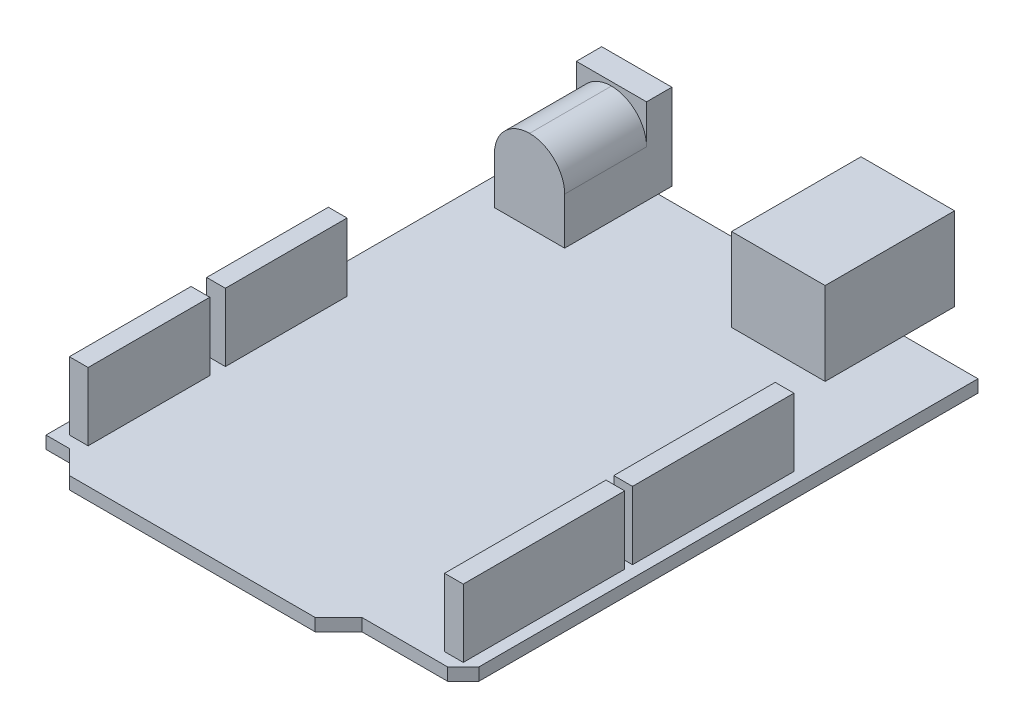
from build123d import *

# Parameters (mm, degrees)
BOSS_EXTRUDE1_DEPTH      = 1.6
CHAMFER1_SIZE            = 2
SKETCH2_W                = 12
SKETCH2_H                = 16.6
BOSS_EXTRUDE2_DEPTH      = 10.65
SKETCH3_W                = 2.4
SKETCH3_H                = 15.6
SKETCH3_H_2              = 20.7
BOSS_EXTRUDE3_DEPTH      = 8.7
BOSS_EXTRUDE4_DEPTH      = 1.75
BOSS_EXTRUDE4_DEPTH_BACK = 1.5
SKETCH4_W                = 9
SKETCH4_H                = 11
SKETCH5_W                = 9
SKETCH5_H                = 10.5
BOSS_EXTRUDE5_DEPTH      = 10.5
FILLET1_R                = 4.5


with BuildPart() as part:
    # Sketch1 → Boss-Extrude1 (new body)
    with BuildSketch(Plane(origin=(0, 0, 0), x_dir=(1, 0, 0), z_dir=(0, 1, 0))):
        Polygon((-26.75, -66), (-23.75, -66), (-20.75, -69), (10.75, -69), (13.75, -66), (26.75, -66), (26.75, 0), (-26.75, 0), align=None)
    extrude(amount=BOSS_EXTRUDE1_DEPTH)

    # Chamfer1
    chamfer1_edges = [part.edges().sort_by_distance(p)[0] for p in [
        (26.75, 0.8, 66),
    ]]
    chamfer(chamfer1_edges, length=CHAMFER1_SIZE)

    # Sketch2 → Boss-Extrude2 (add)
    with BuildSketch(Plane(origin=(0, 1.6, 0), x_dir=(1, 0, 0), z_dir=(0, 1, 0))):
        with Locations((11.25, -1.8)):
            Rectangle(SKETCH2_W, SKETCH2_H)
    extrude(amount=BOSS_EXTRUDE2_DEPTH)

    # Sketch3 → Boss-Extrude3 (add)
    with BuildSketch(Plane(origin=(0, 1.6, 0), x_dir=(1, 0, 0), z_dir=(0, 1, 0))):
        with Locations((-24.05, -56.7)):
            Rectangle(SKETCH3_W, SKETCH3_H)
        with Locations((-24.05, -39.1)):
            Rectangle(SKETCH3_W, SKETCH3_H)
        with Locations((24.05, -54.15)):
            Rectangle(SKETCH3_W, SKETCH3_H_2)
        with Locations((24.05, -32.45)):
            Rectangle(SKETCH3_W, SKETCH3_H_2)
    extrude(amount=BOSS_EXTRUDE3_DEPTH)

    # Sketch4 → Boss-Extrude4 (add, two sides: drawn at the far end of the back side and taken through both)
    with BuildSketch(Plane(origin=(0, 0, 0), x_dir=(-1, 0, 0), z_dir=(0, 0, -1)).offset(-BOSS_EXTRUDE4_DEPTH_BACK)):
        with Locations((18.75, 7.1)):
            Rectangle(SKETCH4_W, SKETCH4_H)
    extrude(amount=BOSS_EXTRUDE4_DEPTH + BOSS_EXTRUDE4_DEPTH_BACK)

    # Sketch5 → Boss-Extrude5 (add)
    with BuildSketch(Plane.XY.offset(1.5)):
        with Locations((-18.75, 6.85)):
            Rectangle(SKETCH5_W, SKETCH5_H)
    extrude(amount=BOSS_EXTRUDE5_DEPTH)

    # Fillet1
    fillet1_edges = [part.edges().sort_by_distance(p)[0] for p in [
        (-14.25, 12.1, 6.75),
        (-23.25, 12.1, 6.75),
    ]]
    fillet(fillet1_edges, radius=FILLET1_R - 0.0001)  # a hair under: the kernel refuses the full size


solid = part.part
